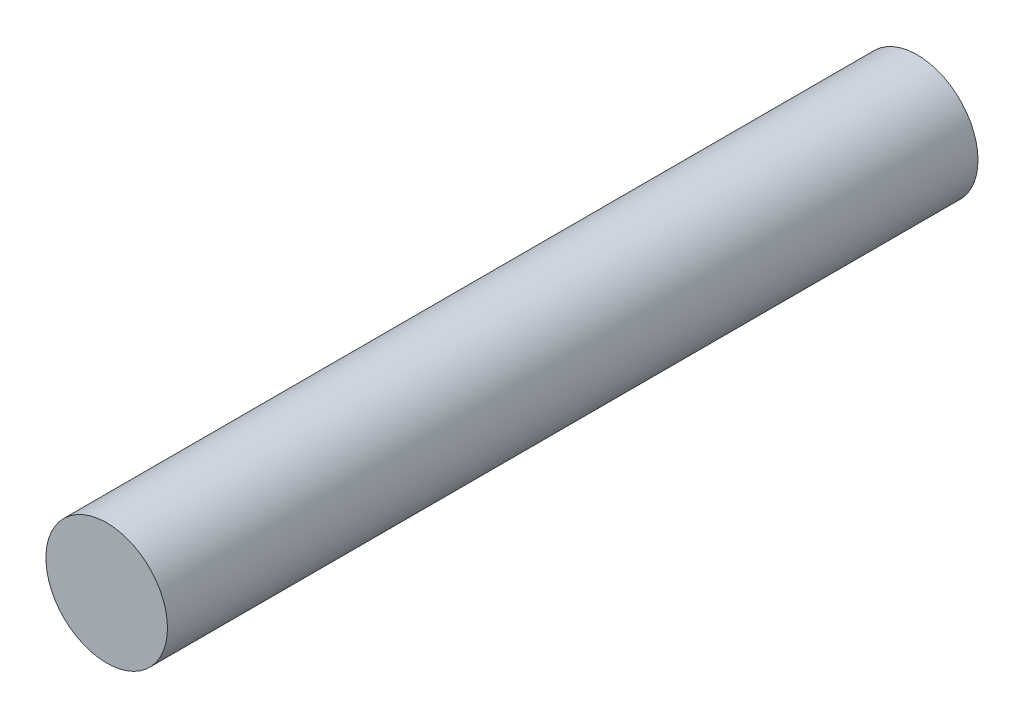
from build123d import *

# Parameters (mm, degrees)
SKETCH1_R           = 15
BOSS_EXTRUDE1_DEPTH = 200


with BuildPart() as part:
    # Sketch1 → Boss-Extrude1 (new body)
    with BuildSketch(Plane.XY):
        Circle(SKETCH1_R)
    extrude(amount=BOSS_EXTRUDE1_DEPTH)


solid = part.part
